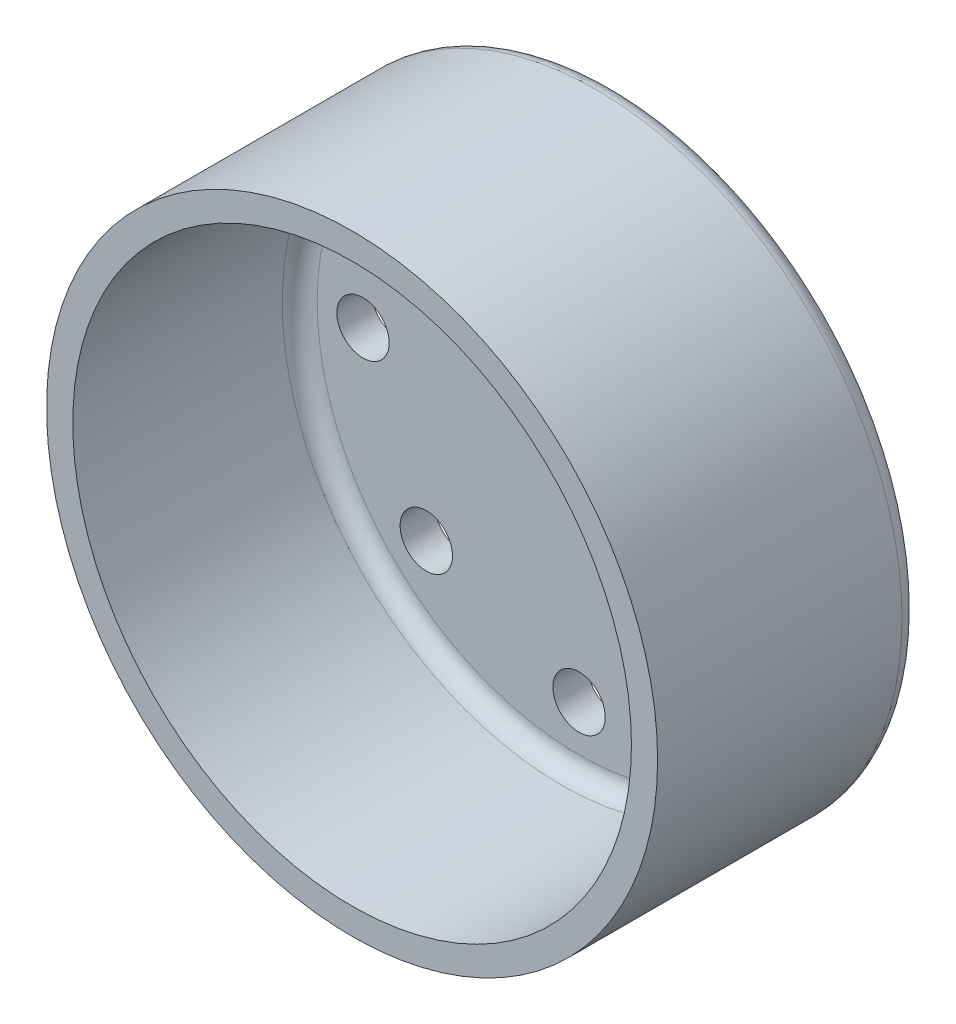
from build123d import *

# Parameters (mm, degrees)
SKETCH1_R           = 35
BOSS_EXTRUDE1_DEPTH = 30
SKETCH3_R           = 3
CUT_EXTRUDE1_DEPTH  = 60
SKETCH3_3_R         = 3
CUT_EXTRUDE2_DEPTH  = 60
SKETCH5_R           = 32
CUT_EXTRUDE3_DEPTH  = 26
FILLET3_R           = 2
FILLET4_R           = 2


with BuildPart() as part:
    # Sketch1 → Boss-Extrude1 (new body)
    with BuildSketch(Plane.XY):
        Circle(SKETCH1_R)
    extrude(amount=BOSS_EXTRUDE1_DEPTH)

    # Sketch3 → Cut-Extrude1 (cut)
    with BuildSketch(Plane(origin=(0, 0, 0), x_dir=(-1, 0, 0), z_dir=(0, 0, -1))):
        with Locations((24.75, 0)):
            Circle(SKETCH3_R)
        with Locations((-17.5, -17.5)):
            Circle(SKETCH3_R)
        with Locations((17.5, -17.5)):
            Circle(SKETCH3_R)
    extrude(amount=-CUT_EXTRUDE1_DEPTH, mode=Mode.SUBTRACT)

    # Sketch3<3> → Cut-Extrude2 (cut)
    with BuildSketch(Plane(origin=(0, 0, 0), x_dir=(-1, 0, 0), z_dir=(0, 0, -1))):
        with Locations((0, -24.75)):
            Circle(SKETCH3_3_R)
        with Locations((-24.75, 0)):
            Circle(SKETCH3_3_R)
    extrude(amount=-CUT_EXTRUDE2_DEPTH, mode=Mode.SUBTRACT)

    # Sketch5 → Cut-Extrude3 (cut)
    with BuildSketch(Plane.XY.offset(30)):
        Circle(SKETCH5_R)
    extrude(amount=-CUT_EXTRUDE3_DEPTH, mode=Mode.SUBTRACT)

    # Fillet3
    fillet3_edges = [part.edges().sort_by_distance(p)[0] for p in [
        (-35, 0, 0),
    ]]
    fillet(fillet3_edges, radius=FILLET3_R)

    # Fillet4
    fillet4_edges = [part.edges().sort_by_distance(p)[0] for p in [
        (-32, 0, 4),
    ]]
    fillet(fillet4_edges, radius=FILLET4_R)


solid = part.part
